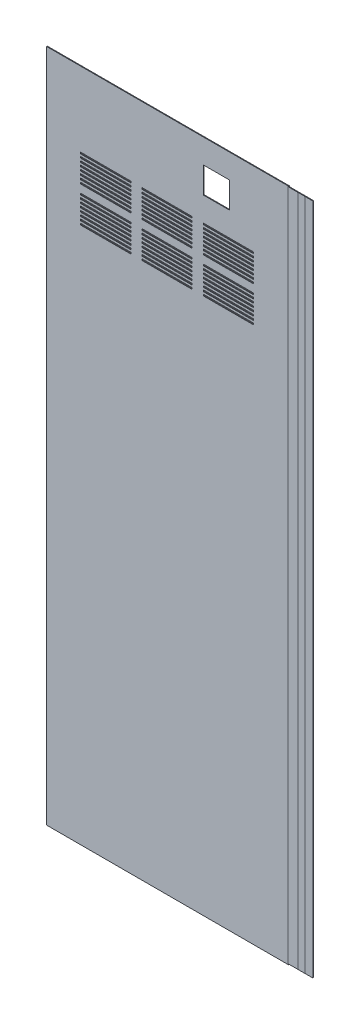
from build123d import *

# Parameters (mm, degrees)
BRIDA_BASE2_DEPTH          = 1810
CORTAR_EXTRUIR1_DEPTH      = 1924.746243661
CORTAR_EXTRUIR1_DEPTH_BACK = 1924.746243661
CROQUIS5_W                 = 58.064635051
CROQUIS5_H                 = 1.9
CROQUIS5_W_2               = 52.43677075
CROQUIS11_W                = 134.8
CROQUIS11_H                = 4
CORTAR_EXTRUIR2_DEPTH      = 1924.152373058
MATRIZL1_COUNT             = 8
MATRIZL1_PITCH             = 10
MATRIZL2_COUNT             = 2
MATRIZL2_PITCH             = 95.4
MATRIZL2_COPY_1_SKETCH_W   = 134.8
MATRIZL2_COPY_1_SKETCH_H   = 4
MATRIZL2_COPY_1_DEPTH      = 1924.152373058
MATRIZL2_COPY_2_SKETCH_W   = 134.8
MATRIZL2_COPY_2_SKETCH_H   = 4
MATRIZL2_COPY_2_DEPTH      = 1924.152373058
MATRIZL2_COPY_3_SKETCH_W   = 134.8
MATRIZL2_COPY_3_SKETCH_H   = 4
MATRIZL2_COPY_3_DEPTH      = 1924.152373058
MATRIZL2_COPY_4_SKETCH_W   = 134.8
MATRIZL2_COPY_4_SKETCH_H   = 4
MATRIZL2_COPY_4_DEPTH      = 1924.152373058
MATRIZL2_COPY_5_SKETCH_W   = 134.8
MATRIZL2_COPY_5_SKETCH_H   = 4
MATRIZL2_COPY_5_DEPTH      = 1924.152373058
MATRIZL2_COPY_6_SKETCH_W   = 134.8
MATRIZL2_COPY_6_SKETCH_H   = 4
MATRIZL2_COPY_6_DEPTH      = 1924.152373058
MATRIZL2_COPY_7_SKETCH_W   = 134.8
MATRIZL2_COPY_7_SKETCH_H   = 4
MATRIZL2_COPY_7_DEPTH      = 1924.152373058
CORTAR_EXTRUIR3_DEPTH      = 1924.152373058
CORTAR_EXTRUIR3_DEPTH_BACK = 1924.152373058
CROQUIS12_W                = 70
CROQUIS12_H                = 70
DESDOBLAR1_DEPTH           = 1810
DESDOBLAR1_START           = 1.9
DESDOBLAR1_2_DEPTH         = 1806.2
DESDOBLAR1_3_DEPTH         = 1810


# Read off the part's stored shape, not the designer's step: Desdoblar1
# Sheet-metal steps are written as plain solids
with BuildPart() as part:
    # Croquis4 → Brida base2 (new body)
    with BuildSketch(Plane(origin=(0, 0, 0), x_dir=(1, 0, 0), z_dir=(0, 1, 0))):
        with BuildLine():
            Line((-648.1, 0), (-0.7366, 0))
            ThreePointArc((-0.7366, 0), (-0.215745145, 0.215745145), (0, 0.7366))
            Line((0, 0.7366), (0, 24.2634))
            ThreePointArc((0, 24.2634), (-0.215745145, 24.784254855), (-0.7366, 25))
            Line((-0.7366, 25), (-17.3634, 25))
            ThreePointArc((-17.3634, 25), (-19.227757739, 25.772242261), (-20, 27.6366))
            Line((-20, 27.6366), (-20, 46.9))
            Line((-20, 46.9), (-18.1, 46.9))
            Line((-18.1, 46.9), (-18.1, 27.6366))
            ThreePointArc((-18.1, 27.6366), (-17.884254855, 27.115745145), (-17.3634, 26.9))
            Line((-17.3634, 26.9), (-0.7366, 26.9))
            ThreePointArc((-0.7366, 26.9), (1.127757739, 26.127757739), (1.9, 24.2634))
            Line((1.9, 24.2634), (1.9, 0.7366))
            ThreePointArc((1.9, 0.7366), (1.127757739, -1.127757739), (-0.7366, -1.9))
            Line((-0.7366, -1.9), (-648.1, -1.9))
            Line((-648.1, -1.9), (-648.1, 0))
        make_face()
    extrude(amount=BRIDA_BASE2_DEPTH)

    # Croquis5 → Cortar-Extruir1 (cut, two sides: drawn at the far end of the back side and taken through both)
    with BuildSketch(Plane(origin=(1.9, 0, 0), x_dir=(0, 0, -1), z_dir=(1, 0, 0)).offset(-CORTAR_EXTRUIR1_DEPTH_BACK)):
        with Locations((29.768917526, 1809.05)):
            Rectangle(CROQUIS5_W, CROQUIS5_H)
        with Locations((26.954985375, 0.95)):
            Rectangle(CROQUIS5_W_2, CROQUIS5_H)
    extrude(amount=CORTAR_EXTRUIR1_DEPTH + CORTAR_EXTRUIR1_DEPTH_BACK, mode=Mode.SUBTRACT)

    # Croquis11 → Cortar-Extruir2 (cut, symmetric)
    with BuildSketch(Plane.XY.offset(1.9)):
        with Locations((-489.2183, 1608)):
            Rectangle(CROQUIS11_W, CROQUIS11_H)
        with Locations((-324.4183, 1608)):
            Rectangle(CROQUIS11_W, CROQUIS11_H)
        with Locations((-159.6183, 1608)):
            Rectangle(CROQUIS11_W, CROQUIS11_H)
    cortar_extruir2 = extrude(amount=CORTAR_EXTRUIR2_DEPTH, both=True, mode=Mode.SUBTRACT)

    # MatrizL1: Cortar-Extruir2 ×8
    with Locations(*[(0, -i * MATRIZL1_PITCH, 0) for i in range(1, MATRIZL1_COUNT)]):
        add(cortar_extruir2, mode=Mode.SUBTRACT)

    # MatrizL2: Cortar-Extruir2 ×2
    with Locations(*[(0, -i * MATRIZL2_PITCH, 0) for i in range(1, MATRIZL2_COUNT)]):
        add(cortar_extruir2, mode=Mode.SUBTRACT)

    # MatrizL2 copy 1 sketch → MatrizL2 copy 1 (cut, symmetric)
    with BuildSketch(Plane(origin=(0, -105.4, 1.9), x_dir=(1, 0, 0), z_dir=(0, 0, 1))):
        with Locations((-489.2183, 1608)):
            Rectangle(MATRIZL2_COPY_1_SKETCH_W, MATRIZL2_COPY_1_SKETCH_H)
        with Locations((-324.4183, 1608)):
            Rectangle(MATRIZL2_COPY_1_SKETCH_W, MATRIZL2_COPY_1_SKETCH_H)
        with Locations((-159.6183, 1608)):
            Rectangle(MATRIZL2_COPY_1_SKETCH_W, MATRIZL2_COPY_1_SKETCH_H)
    extrude(amount=MATRIZL2_COPY_1_DEPTH, both=True, mode=Mode.SUBTRACT)

    # MatrizL2 copy 2 sketch → MatrizL2 copy 2 (cut, symmetric)
    with BuildSketch(Plane(origin=(0, -115.4, 1.9), x_dir=(1, 0, 0), z_dir=(0, 0, 1))):
        with Locations((-489.2183, 1608)):
            Rectangle(MATRIZL2_COPY_2_SKETCH_W, MATRIZL2_COPY_2_SKETCH_H)
        with Locations((-324.4183, 1608)):
            Rectangle(MATRIZL2_COPY_2_SKETCH_W, MATRIZL2_COPY_2_SKETCH_H)
        with Locations((-159.6183, 1608)):
            Rectangle(MATRIZL2_COPY_2_SKETCH_W, MATRIZL2_COPY_2_SKETCH_H)
    extrude(amount=MATRIZL2_COPY_2_DEPTH, both=True, mode=Mode.SUBTRACT)

    # MatrizL2 copy 3 sketch → MatrizL2 copy 3 (cut, symmetric)
    with BuildSketch(Plane(origin=(0, -125.4, 1.9), x_dir=(1, 0, 0), z_dir=(0, 0, 1))):
        with Locations((-489.2183, 1608)):
            Rectangle(MATRIZL2_COPY_3_SKETCH_W, MATRIZL2_COPY_3_SKETCH_H)
        with Locations((-324.4183, 1608)):
            Rectangle(MATRIZL2_COPY_3_SKETCH_W, MATRIZL2_COPY_3_SKETCH_H)
        with Locations((-159.6183, 1608)):
            Rectangle(MATRIZL2_COPY_3_SKETCH_W, MATRIZL2_COPY_3_SKETCH_H)
    extrude(amount=MATRIZL2_COPY_3_DEPTH, both=True, mode=Mode.SUBTRACT)

    # MatrizL2 copy 4 sketch → MatrizL2 copy 4 (cut, symmetric)
    with BuildSketch(Plane(origin=(0, -135.4, 1.9), x_dir=(1, 0, 0), z_dir=(0, 0, 1))):
        with Locations((-489.2183, 1608)):
            Rectangle(MATRIZL2_COPY_4_SKETCH_W, MATRIZL2_COPY_4_SKETCH_H)
        with Locations((-324.4183, 1608)):
            Rectangle(MATRIZL2_COPY_4_SKETCH_W, MATRIZL2_COPY_4_SKETCH_H)
        with Locations((-159.6183, 1608)):
            Rectangle(MATRIZL2_COPY_4_SKETCH_W, MATRIZL2_COPY_4_SKETCH_H)
    extrude(amount=MATRIZL2_COPY_4_DEPTH, both=True, mode=Mode.SUBTRACT)

    # MatrizL2 copy 5 sketch → MatrizL2 copy 5 (cut, symmetric)
    with BuildSketch(Plane(origin=(0, -145.4, 1.9), x_dir=(1, 0, 0), z_dir=(0, 0, 1))):
        with Locations((-489.2183, 1608)):
            Rectangle(MATRIZL2_COPY_5_SKETCH_W, MATRIZL2_COPY_5_SKETCH_H)
        with Locations((-324.4183, 1608)):
            Rectangle(MATRIZL2_COPY_5_SKETCH_W, MATRIZL2_COPY_5_SKETCH_H)
        with Locations((-159.6183, 1608)):
            Rectangle(MATRIZL2_COPY_5_SKETCH_W, MATRIZL2_COPY_5_SKETCH_H)
    extrude(amount=MATRIZL2_COPY_5_DEPTH, both=True, mode=Mode.SUBTRACT)

    # MatrizL2 copy 6 sketch → MatrizL2 copy 6 (cut, symmetric)
    with BuildSketch(Plane(origin=(0, -155.4, 1.9), x_dir=(1, 0, 0), z_dir=(0, 0, 1))):
        with Locations((-489.2183, 1608)):
            Rectangle(MATRIZL2_COPY_6_SKETCH_W, MATRIZL2_COPY_6_SKETCH_H)
        with Locations((-324.4183, 1608)):
            Rectangle(MATRIZL2_COPY_6_SKETCH_W, MATRIZL2_COPY_6_SKETCH_H)
        with Locations((-159.6183, 1608)):
            Rectangle(MATRIZL2_COPY_6_SKETCH_W, MATRIZL2_COPY_6_SKETCH_H)
    extrude(amount=MATRIZL2_COPY_6_DEPTH, both=True, mode=Mode.SUBTRACT)

    # MatrizL2 copy 7 sketch → MatrizL2 copy 7 (cut, symmetric)
    with BuildSketch(Plane(origin=(0, -165.4, 1.9), x_dir=(1, 0, 0), z_dir=(0, 0, 1))):
        with Locations((-489.2183, 1608)):
            Rectangle(MATRIZL2_COPY_7_SKETCH_W, MATRIZL2_COPY_7_SKETCH_H)
        with Locations((-324.4183, 1608)):
            Rectangle(MATRIZL2_COPY_7_SKETCH_W, MATRIZL2_COPY_7_SKETCH_H)
        with Locations((-159.6183, 1608)):
            Rectangle(MATRIZL2_COPY_7_SKETCH_W, MATRIZL2_COPY_7_SKETCH_H)
    extrude(amount=MATRIZL2_COPY_7_DEPTH, both=True, mode=Mode.SUBTRACT)

    # Croquis12 → Cortar-Extruir3 (cut, two sides: drawn at the far end of the back side and taken through both)
    with BuildSketch(Plane.XY.offset(1.9).offset(-CORTAR_EXTRUIR3_DEPTH_BACK)):
        with Locations((-192.0183, 1710)):
            Rectangle(CROQUIS12_W, CROQUIS12_H)
    extrude(amount=CORTAR_EXTRUIR3_DEPTH + CORTAR_EXTRUIR3_DEPTH_BACK, mode=Mode.SUBTRACT)

    # Desdoblar1 outline → Desdoblar1 (cut)
    with BuildSketch(Plane(origin=(0, 0, 0), x_dir=(1, 0, 0), z_dir=(0, 1, 0))):
        with BuildLine():
            Line((-0.7366, 0), (1.795016084, 0))
            ThreePointArc((1.795016084, 0), (1.873622072, 0.364578098), (1.9, 0.7366))
            Line((1.9, 0.7366), (1.9, 24.2634))
            ThreePointArc((1.9, 24.2634), (1.127757739, 26.127757739), (-0.7366, 26.9))
            Line((-0.7366, 26.9), (-17.3634, 26.9))
            ThreePointArc((-17.3634, 26.9), (-17.884254855, 27.115745145), (-18.1, 27.6366))
            Line((-18.1, 27.6366), (-18.1, 46.9))
            Line((-18.1, 46.9), (-20, 46.9))
            Line((-20, 46.9), (-20, 27.6366))
            ThreePointArc((-20, 27.6366), (-19.227757739, 25.772242261), (-17.3634, 25))
            Line((-17.3634, 25), (-0.7366, 25))
            ThreePointArc((-0.7366, 25), (-0.215745145, 24.784254855), (0, 24.2634))
            Line((0, 24.2634), (0, 0.7366))
            ThreePointArc((0, 0.7366), (-0.215745145, 0.215745145), (-0.7366, 0))
        make_face()
    extrude(amount=DESDOBLAR1_DEPTH, mode=Mode.SUBTRACT)

    # Desdoblar1 2 outline → Desdoblar1 2 (add)
    with BuildSketch(Plane(origin=(0, 0, 0), x_dir=(1, 0, 0), z_dir=(0, 1, 0)).offset(DESDOBLAR1_START)):
        with BuildLine():
            ThreePointArc((1.795016084, 0), (0.846046517, -1.372164937), (-0.7366, -1.9))
            Line((-0.7366, -1.9), (66.628315254, -1.9))
            Line((66.628315254, -1.9), (66.628315254, 0))
            Line((66.628315254, 0), (1.795016084, 0))
        make_face()
    extrude(amount=DESDOBLAR1_2_DEPTH)

    # Desdoblar1 3 outline → Desdoblar1 3 (add)
    with BuildSketch(Plane(origin=(0, 0, 0), x_dir=(1, 0, 0), z_dir=(0, 1, 0))):
        with BuildLine():
            Line((1.912705085, -1.9), (1.912705085, 0))
            Line((1.912705085, 0), (1.795016084, 0))
            ThreePointArc((1.795016084, 0), (0.846046517, -1.372164937), (-0.7366, -1.9))
            Line((-0.7366, -1.9), (1.912705085, -1.9))
        make_face()
    extrude(amount=DESDOBLAR1_3_DEPTH)


solid = part.part
